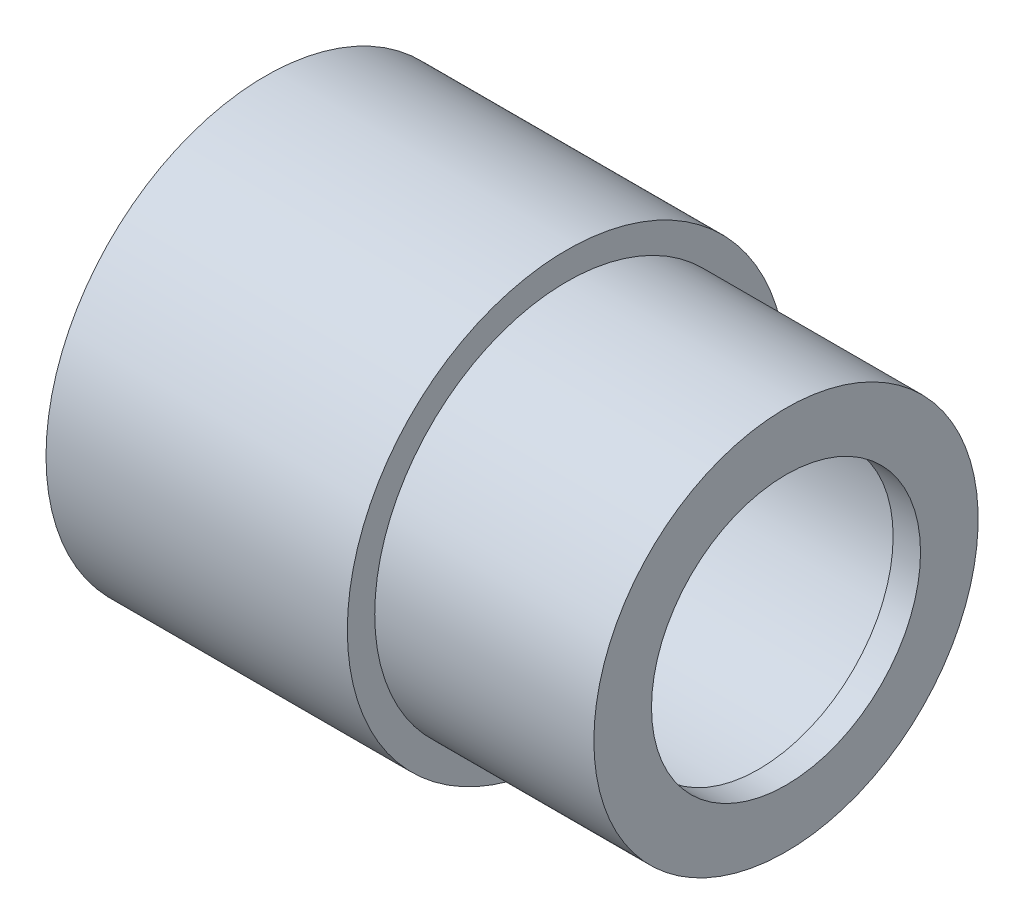
from build123d import *


with BuildPart() as part:
    # Sketch1 → Revolve1 (revolve)
    with BuildSketch(Plane.XY):
        Polygon((0, 89.080500759), (0, 101.780500759), (139.7, 101.780500759), (139.7, 89.080500759), (241.3, 89.080500759), (241.3, 62.361436962), (228.6, 62.361436962), (228.6, 76.380500759), (127, 76.380500759), (127, 89.080500759), align=None)
    revolve(axis=Axis((0, 0, 0), (1, 0, 0)))


solid = part.part
